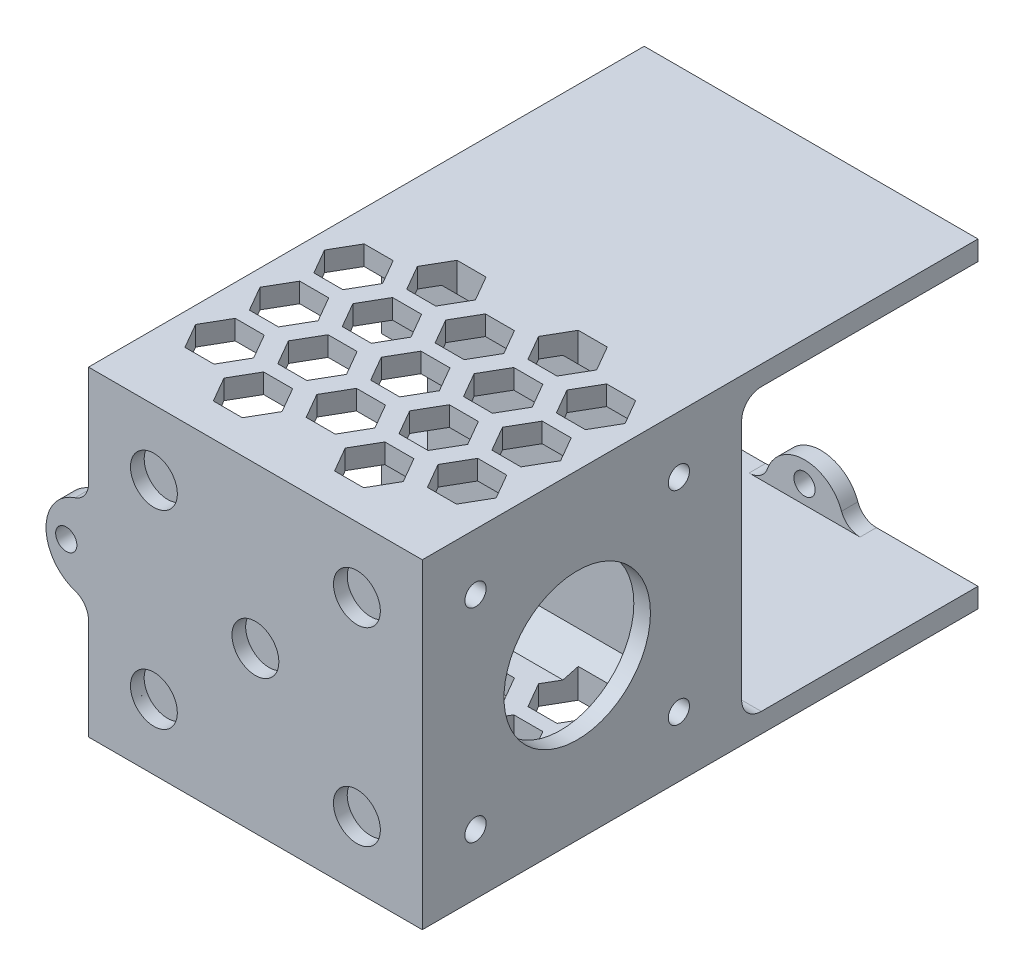
from build123d import *

# Parameters (mm, degrees)
BOSS_EXTRUDE1_DEPTH = 84.985
SKETCH2_W           = 4
SKETCH2_H           = 43
BOSS_EXTRUDE2_DEPTH = 48.05
SKETCH9_W           = 2.54
SKETCH9_H           = 43
BOSS_EXTRUDE5_DEPTH = 48.05
SKETCH10_R          = 3.585
CUT_EXTRUDE1_DEPTH  = 2.1
SKETCH11_W          = 7
SKETCH11_H          = 13
CUT_EXTRUDE2_DEPTH  = 4
SKETCH13_R          = 1.625
BOSS_EXTRUDE6_DEPTH = 2.5
FILLET1_R           = 3
CHAMFER2_SIZE       = 4
CUT_EXTRUDE3_DEPTH  = 3
SKETCH20_R          = 1.625
SKETCH20_R_2        = 11.2
BOSS_EXTRUDE7_DEPTH = 2.54
SKETCH22_W          = 36.145
SKETCH22_H          = 43
CUT_EXTRUDE4_DEPTH  = 3
FILLET2_R           = 3
FILL_START          = -3
FILL_PATTERN2_DEPTH = 49
SKETCH24_R          = 1.625
BOSS_EXTRUDE8_DEPTH = 2.54
FILLET3_R           = 3


# Read off the part's stored shape, not the designer's step: Fill Pattern2
with BuildPart() as part:
    # Sketch1 → Boss-Extrude1 (new body)
    with BuildSketch(Plane.XY):
        Polygon((0, 0), (-48.05, 0), (-48.05, 43), (0, 43), (0, 46), (-51.05, 46), (-51.05, -3), (0, -3), align=None)
    extrude(amount=BOSS_EXTRUDE1_DEPTH)

    # Sketch2 → Boss-Extrude2 (add)
    with BuildSketch(Plane(origin=(-48.05, 0, 0), x_dir=(0, 0, -1), z_dir=(1, 0, 0))):
        with Locations((-38.145, 21.5)):
            Rectangle(SKETCH2_W, SKETCH2_H)
    extrude(amount=BOSS_EXTRUDE2_DEPTH)

    # Sketch9 → Boss-Extrude5 (add)
    with BuildSketch(Plane(origin=(-48.05, 0, 0), x_dir=(0, 0, -1), z_dir=(1, 0, 0))):
        with Locations((-83.715, 21.5)):
            Rectangle(SKETCH9_W, SKETCH9_H)
    extrude(amount=BOSS_EXTRUDE5_DEPTH)

    # Sketch10 → Cut-Extrude1 (cut)
    with BuildSketch(Plane.XY.offset(84.985)):
        with Locations((-41.05, 7)):
            Circle(SKETCH10_R)
        with Locations(Location((-41.05, 36, 0), (0, 0, 180))):
            Circle(SKETCH10_R)
        with Locations(Location((-10, 7, 0), (0, 0, 180))):
            Circle(SKETCH10_R)
        with Locations((-10, 36)):
            Circle(SKETCH10_R)
        with Locations((-25.525, 21.5)):
            Circle(SKETCH10_R)
    extrude(amount=-CUT_EXTRUDE1_DEPTH, mode=Mode.SUBTRACT)

    # Sketch11 → Cut-Extrude2 (cut)
    with BuildSketch(Plane.XY.offset(40.145)):
        with Locations((-47.55, 21.5)):
            Rectangle(SKETCH11_W, SKETCH11_H)
    extrude(amount=-CUT_EXTRUDE2_DEPTH, mode=Mode.SUBTRACT)

    # Sketch13 → Boss-Extrude6 (add)
    with BuildSketch(Plane.XY):
        with BuildLine():
            Line((-18.025, 43), (-30.025, 43))
            ThreePointArc((-30.025, 43), (-24.025, 37), (-18.025, 43))
        make_face()
        with Locations((-24.025, 40.2)):
            Circle(SKETCH13_R, mode=Mode.SUBTRACT)
    boss_extrude6 = extrude(amount=BOSS_EXTRUDE6_DEPTH)

    # Mirror6: Boss-Extrude6 across plane
    add(boss_extrude6.mirror(Plane.ZX.offset(21.5)))

    # Fillet1
    fillet1_edges = [part.edges().sort_by_distance(p)[0] for p in [
        (-30.025, 43, 1.25),
        (-18.025, 43, 1.25),
        (-18.025, 0, 1.25),
        (-30.025, 0, 1.25),
    ]]
    fillet(fillet1_edges, radius=FILLET1_R)

    # Chamfer2
    chamfer2_edges = [part.edges().sort_by_distance(p)[0] for p in [
        (-24.025, 0, 40.145),
        (-24.025, 43, 40.145),
        (-24.025, 0, 82.445),
        (-24.025, 43, 82.445),
    ]]
    chamfer(chamfer2_edges, length=CHAMFER2_SIZE)

    # Sketch19 → Cut-Extrude3 (cut)
    with BuildSketch(Plane(origin=(-48.05, 0, 0), x_dir=(0, 0, -1), z_dir=(1, 0, 0))):
        Polygon((-40.145, 28), (-40.145, 15), (-40.145, 4), (-44.145, 0), (-78.445, 0), (-82.445, 4), (-82.445, 39), (-78.445, 43), (-44.145, 43), (-40.145, 39), align=None)
    extrude(amount=-CUT_EXTRUDE3_DEPTH, mode=Mode.SUBTRACT)

    # Sketch20 → Boss-Extrude7 (add)
    with BuildSketch(Plane(origin=(0, 0, 0), x_dir=(0, 0, -1), z_dir=(1, 0, 0))):
        Polygon((-78.445, 43), (-44.145, 43), (-40.145, 39), (-40.145, 4), (-44.145, 0), (-78.445, 0), (-82.445, 4), (-82.445, 39), align=None)
        with Locations((-76.845, 6.234203655)):
            Circle(SKETCH20_R, mode=Mode.SUBTRACT)
        with Locations((-45.745, 6.234203655)):
            Circle(SKETCH20_R, mode=Mode.SUBTRACT)
        with Locations((-45.745, 37.334203655)):
            Circle(SKETCH20_R, mode=Mode.SUBTRACT)
        with Locations((-76.845, 37.334203655)):
            Circle(SKETCH20_R, mode=Mode.SUBTRACT)
        with Locations((-61.295, 21.5)):
            Circle(SKETCH20_R_2, mode=Mode.SUBTRACT)
    extrude(amount=-BOSS_EXTRUDE7_DEPTH)

    # Sketch22 → Cut-Extrude4 (cut)
    with BuildSketch(Plane(origin=(-48.05, 0, 0), x_dir=(0, 0, -1), z_dir=(1, 0, 0))):
        with Locations((-18.0725, 21.5)):
            Rectangle(SKETCH22_W, SKETCH22_H)
    extrude(amount=-CUT_EXTRUDE4_DEPTH, mode=Mode.SUBTRACT)

    # Fillet2
    fillet2_edges = [part.edges().sort_by_distance(p)[0] for p in [
        (-25.525, 0, 36.145),
        (-25.525, 43, 36.145),
    ]]
    fillet(fillet2_edges, radius=FILLET2_R)

    # Fill Pattern2 outline → Fill Pattern2 (cut)
    with BuildSketch(Plane(origin=(0, 0, 0), x_dir=(1, 0, 0), z_dir=(0, 1, 0)).offset(FILL_START)):
        Polygon((-30.356284668, -46.506645772), (-32.576117197, -42.661783049), (-37.015782253, -42.661783049), (-39.235614782, -46.506645772), (-37.015782253, -50.351508496), (-32.576117197, -50.351508496), align=None)
        Polygon((-14.034217747, -42.661783049), (-18.473882803, -42.661783049), (-20.693715332, -46.506645772), (-18.473882803, -50.351508496), (-14.034217747, -50.351508496), (-11.814385218, -46.506645772), align=None)
        Polygon((-21.085334943, -71.153902819), (-23.305167472, -67.309040095), (-27.744832528, -67.309040095), (-29.964665057, -71.153902819), (-27.744832528, -74.998765542), (-23.305167472, -74.998765542), align=None)
        Polygon((-41.847066922, -67.309040095), (-46.286731978, -67.309040095), (-48.506564507, -71.153902819), (-46.286731978, -74.998765542), (-41.847066922, -74.998765542), (-39.627234393, -71.153902819), align=None)
        Polygon((-4.763268022, -67.309040095), (-9.202933078, -67.309040095), (-11.422765607, -71.153902819), (-9.202933078, -74.998765542), (-4.763268022, -74.998765542), (-2.543435493, -71.153902819), align=None)
        Polygon((-21.085334943, -61.295), (-23.305167472, -57.450137277), (-27.744832528, -57.450137277), (-29.964665057, -61.295), (-27.744832528, -65.139862723), (-23.305167472, -65.139862723), align=None)
        Polygon((-41.847066922, -57.450137277), (-46.286731978, -57.450137277), (-48.506564507, -61.295), (-46.286731978, -65.139862723), (-41.847066922, -65.139862723), (-39.627234393, -61.295), align=None)
        Polygon((-4.763268022, -57.450137277), (-9.202933078, -57.450137277), (-11.422765607, -61.295), (-9.202933078, -65.139862723), (-4.763268022, -65.139862723), (-2.543435493, -61.295), align=None)
        Polygon((-30.356284668, -56.365548591), (-32.576117197, -52.520685867), (-37.015782253, -52.520685867), (-39.235614782, -56.365548591), (-37.015782253, -60.210411314), (-32.576117197, -60.210411314), align=None)
        Polygon((-14.034217747, -52.520685867), (-18.473882803, -52.520685867), (-20.693715332, -56.365548591), (-18.473882803, -60.210411314), (-14.034217747, -60.210411314), (-11.814385218, -56.365548591), align=None)
        Polygon((-11.814385218, -76.083354228), (-14.034217747, -72.238491504), (-18.473882803, -72.238491504), (-20.693715332, -76.083354228), (-18.473882803, -79.928216951), (-14.034217747, -79.928216951), align=None)
        Polygon((-32.576117197, -72.238491504), (-37.015782253, -72.238491504), (-39.235614782, -76.083354228), (-37.015782253, -79.928216951), (-32.576117197, -79.928216951), (-30.356284668, -76.083354228), align=None)
        Polygon((-30.356284668, -66.224451409), (-32.576117197, -62.379588686), (-37.015782253, -62.379588686), (-39.235614782, -66.224451409), (-37.015782253, -70.069314133), (-32.576117197, -70.069314133), align=None)
        Polygon((-14.034217747, -62.379588686), (-18.473882803, -62.379588686), (-20.693715332, -66.224451409), (-18.473882803, -70.069314133), (-14.034217747, -70.069314133), (-11.814385218, -66.224451409), align=None)
        Polygon((-2.543435493, -51.436097181), (-4.763268022, -47.591234458), (-9.202933078, -47.591234458), (-11.422765607, -51.436097181), (-9.202933078, -55.280959905), (-4.763268022, -55.280959905), align=None)
        Polygon((-41.847066922, -47.591234458), (-46.286731978, -47.591234458), (-48.506564507, -51.436097181), (-46.286731978, -55.280959905), (-41.847066922, -55.280959905), (-39.627234393, -51.436097181), align=None)
        Polygon((-23.305167472, -47.591234458), (-27.744832528, -47.591234458), (-29.964665057, -51.436097181), (-27.744832528, -55.280959905), (-23.305167472, -55.280959905), (-21.085334943, -51.436097181), align=None)
    extrude(amount=FILL_PATTERN2_DEPTH, mode=Mode.SUBTRACT)

    # Sketch24 → Boss-Extrude8 (add)
    with BuildSketch(Plane.XY.offset(84.985)):
        with BuildLine():
            Line((-51.05, 15), (-51.05, 28))
            ThreePointArc((-51.05, 28), (-57.55, 21.5), (-51.05, 15))
        make_face()
        with Locations((-54.45, 21.5)):
            Circle(SKETCH24_R, mode=Mode.SUBTRACT)
    extrude(amount=-BOSS_EXTRUDE8_DEPTH)

    # Fillet3
    fillet3_edges = [part.edges().sort_by_distance(p)[0] for p in [
        (-51.05, 28, 83.715),
        (-51.05, 15, 83.715),
    ]]
    fillet(fillet3_edges, radius=FILLET3_R)


solid = part.part
